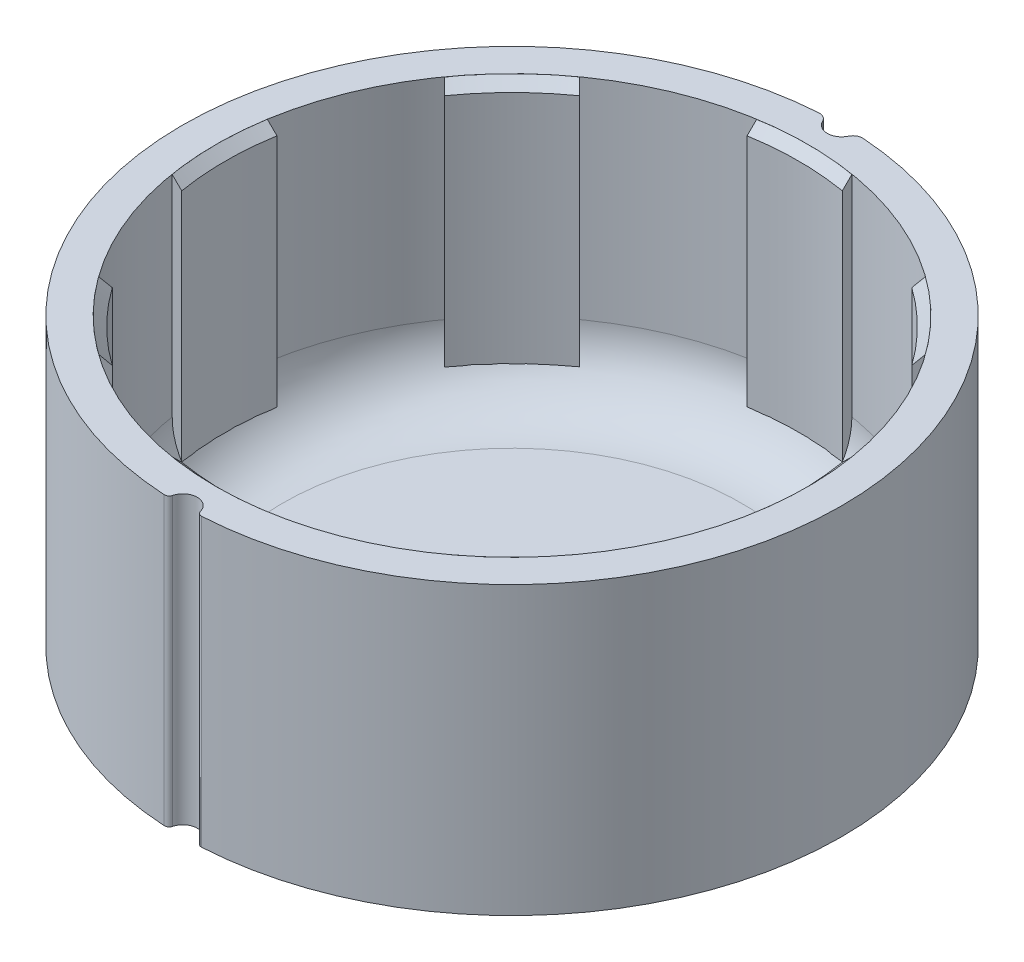
from build123d import *

# Parameters (mm, degrees)
BOSS_EXTRUDE1_DEPTH = 30
CUT_EXTRUDE2_REACH  = 60.241
CUT_EXTRUDE2_START  = 1
SKETCH2_R           = 31
BOSS_EXTRUDE2_DEPTH = 30
CHAMFER2_SIZE       = 1
CIRPATTERN2_COUNT   = 8
FILLET2_R           = 7


with BuildPart() as part:
    # Sketch1 → Boss-Extrude1 (new body)
    with BuildSketch(Plane(origin=(0, 0, 0), x_dir=(1, 0, 0), z_dir=(0, 1, 0))):
        with BuildLine():
            ThreePointArc((1.451818925, -34.068556857), (1.641248992, -34.346908706), (1.964225605, -34.442038138))
            ThreePointArc((1.964225605, -34.442038138), (34.499528846, -0.178302888), (2.324135821, 34.423627607))
            ThreePointArc((2.324135821, 34.423627607), (1.751838249, 34.289058819), (1.354061739, 33.856153382))
            ThreePointArc((1.354061739, 33.856153382), (0, 33.001534515), (-1.354061739, 33.856153382))
            ThreePointArc((-1.354061739, 33.856153382), (-1.751838249, 34.289058819), (-2.324135821, 34.423627607))
            ThreePointArc((-2.324135821, 34.423627607), (-34.499528846, -0.178302888), (-1.964225605, -34.442038138))
            ThreePointArc((-1.964225605, -34.442038138), (-1.641248992, -34.346908706), (-1.451818925, -34.068556857))
            ThreePointArc((-1.451818925, -34.068556857), (0, -32.945679925), (1.451818925, -34.068556857))
        make_face()
    extrude(amount=BOSS_EXTRUDE1_DEPTH)

    # Sketch2 → Cut-Extrude2 (cut, up to next)
    with BuildSketch(Plane(origin=(0, 0, 0), x_dir=(1, 0, 0), z_dir=(0, 1, 0)).offset(CUT_EXTRUDE2_START), mode=Mode.PRIVATE) as cut_extrude2_sk1:
        with Locations(Location((0, 0, 0), (0, 0, 270))):
            Circle(SKETCH2_R)
    cut_extrude2_tool1 = extrude(cut_extrude2_sk1.sketch, amount=CUT_EXTRUDE2_REACH, mode=Mode.PRIVATE) & part.part
    add(cut_extrude2_tool1.solids().sort_by_distance((0, 1, 0))[0], mode=Mode.SUBTRACT)

    # Fillet2
    fillet2_edges = [part.edges().sort_by_distance(p)[0] for p in [
        (0, 1, -31),
    ]]
    fillet(fillet2_edges, radius=FILLET2_R)


with BuildPart() as body_2:
    # Sketch2<2> → Boss-Extrude2 (new body)
    with BuildSketch(Plane(origin=(0, 0, 0), x_dir=(1, 0, 0), z_dir=(0, 1, 0))):
        with BuildLine():
            ThreePointArc((4.983714373, 30.596774194), (0, 31), (-4.983714373, 30.596774194))
            Line((-4.983714373, 30.596774194), (-4.983714373, 29.583147078))
            ThreePointArc((-4.983714373, 29.583147078), (0, 30), (4.983714373, 29.583147078))
            Line((4.983714373, 29.583147078), (4.983714373, 30.596774194))
        make_face()
    extrude(amount=BOSS_EXTRUDE2_DEPTH)

    # Chamfer2
    chamfer2_edges = [body_2.edges().sort_by_distance(p)[0] for p in [
        (0, 30, -30),
    ]]
    chamfer(chamfer2_edges, length=CHAMFER2_SIZE - 0.0001)  # a hair under: the kernel refuses the full size


with BuildPart() as cirpattern2_1:
    # CirPattern2: pattern copy
    add(body_2.part.rotate(Axis((0, 0, 0), (0, 1, 0)), 1 * 360 / CIRPATTERN2_COUNT))


with BuildPart() as cirpattern2_2:
    # CirPattern2: pattern copy
    add(body_2.part.rotate(Axis((0, 0, 0), (0, 1, 0)), 2 * 360 / CIRPATTERN2_COUNT))


with BuildPart() as cirpattern2_3:
    # CirPattern2: pattern copy
    add(body_2.part.rotate(Axis((0, 0, 0), (0, 1, 0)), 3 * 360 / CIRPATTERN2_COUNT))


with BuildPart() as cirpattern2_4:
    # CirPattern2: pattern copy
    add(body_2.part.rotate(Axis((0, 0, 0), (0, 1, 0)), 4 * 360 / CIRPATTERN2_COUNT))


with BuildPart() as cirpattern2_5:
    # CirPattern2: pattern copy
    add(body_2.part.rotate(Axis((0, 0, 0), (0, 1, 0)), 5 * 360 / CIRPATTERN2_COUNT))


with BuildPart() as cirpattern2_6:
    # CirPattern2: pattern copy
    add(body_2.part.rotate(Axis((0, 0, 0), (0, 1, 0)), 6 * 360 / CIRPATTERN2_COUNT))


with BuildPart() as cirpattern2_7:
    # CirPattern2: pattern copy
    add(body_2.part.rotate(Axis((0, 0, 0), (0, 1, 0)), 7 * 360 / CIRPATTERN2_COUNT))


solid = Compound([part.part, body_2.part, cirpattern2_1.part, cirpattern2_2.part, cirpattern2_3.part, cirpattern2_4.part, cirpattern2_5.part, cirpattern2_6.part, cirpattern2_7.part])
